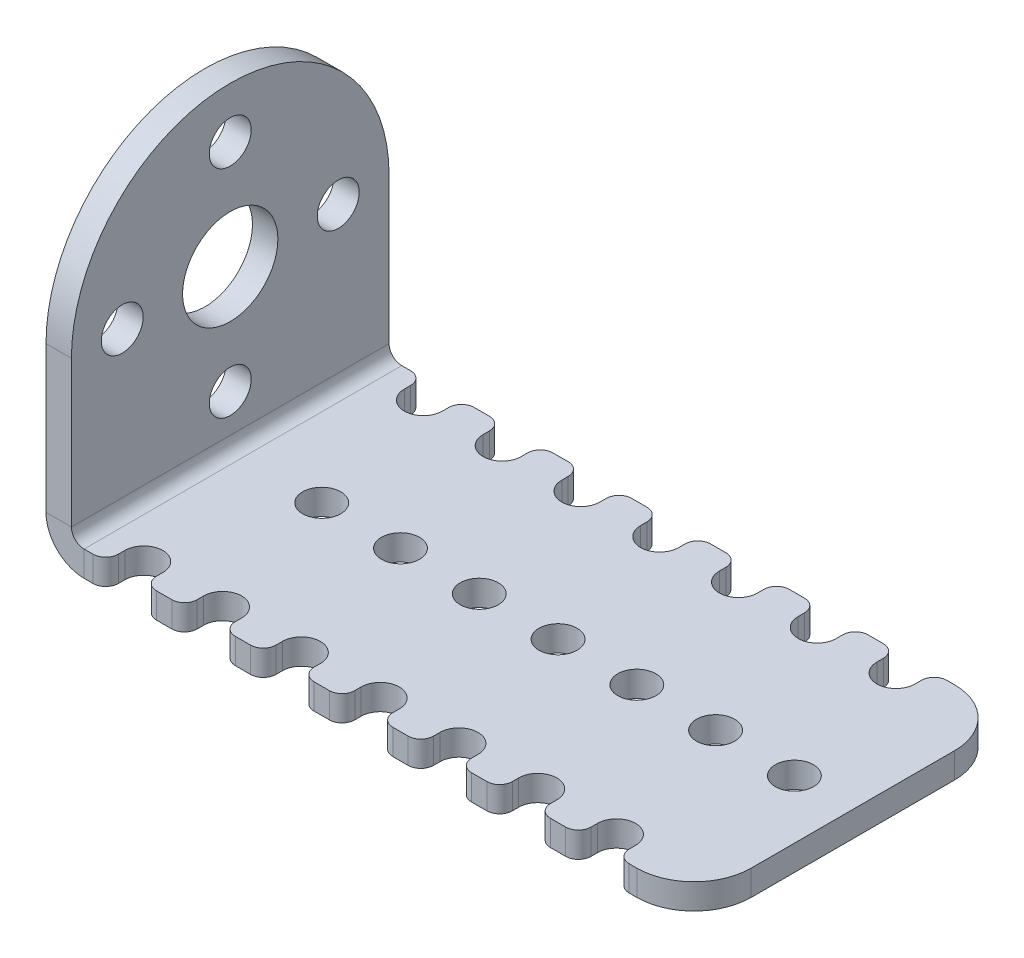
from build123d import *

# Parameters (mm, degrees)
BOSS_EXTRUDE1_DEPTH    = 2
FILLET1_R              = 1
SKETCH2_R              = 1.65
BOSS_EXTRUDE2_DEPTH    = 2
CONVERT_SOLID1_START   = -25
CONVERT_SOLID1_DEPTH   = 25
CONVERT_SOLID1_2_DEPTH = 25


# Read off the part's stored shape, not the designer's step: Convert-Solid1
with BuildPart() as part:
    # Sketch1 → Boss-Extrude1 (new body)
    with BuildSketch(Plane(origin=(0, 0, 0), x_dir=(1, 0, 0), z_dir=(0, 1, 0))):
        with BuildLine():
            Line((51, 12.5), (47.9, 12.5))
            ThreePointArc((47.9, 12.5), (46.4, 11), (44.9, 12.5))
            Line((44.9, 12.5), (41.7, 12.5))
            ThreePointArc((41.7, 12.5), (40.2, 11), (38.7, 12.5))
            Line((38.7, 12.5), (35.5, 12.5))
            ThreePointArc((35.5, 12.5), (34, 11), (32.5, 12.5))
            Line((32.5, 12.5), (29.3, 12.5))
            ThreePointArc((29.3, 12.5), (27.8, 11), (26.3, 12.5))
            Line((26.3, 12.5), (23.1, 12.5))
            ThreePointArc((23.1, 12.5), (21.6, 11), (20.1, 12.5))
            Line((20.1, 12.5), (16.9, 12.5))
            ThreePointArc((16.9, 12.5), (15.4, 11), (13.9, 12.5))
            Line((13.9, 12.5), (10.7, 12.5))
            ThreePointArc((10.7, 12.5), (9.2, 11), (7.7, 12.5))
            Line((7.7, 12.5), (0, 12.5))
            Line((0, 12.5), (0, 0))
            Line((0, 0), (4.7, 0))
            Line((4.7, 0), (4.7, 1.5))
            ThreePointArc((4.7, 1.5), (6.2, 3), (7.7, 1.5))
            Line((7.7, 1.5), (7.7, 0))
            Line((7.7, 0), (10.9, 0))
            Line((10.9, 0), (10.9, 1.5))
            ThreePointArc((10.9, 1.5), (12.4, 3), (13.9, 1.5))
            Line((13.9, 1.5), (13.9, 0))
            Line((13.9, 0), (17.1, 0))
            Line((17.1, 0), (17.1, 1.5))
            ThreePointArc((17.1, 1.5), (18.6, 3), (20.1, 1.5))
            Line((20.1, 1.5), (20.1, 0))
            Line((20.1, 0), (23.3, 0))
            Line((23.3, 0), (23.3, 1.5))
            ThreePointArc((23.3, 1.5), (24.8, 3), (26.3, 1.5))
            Line((26.3, 1.5), (26.3, 0))
            Line((26.3, 0), (29.5, 0))
            Line((29.5, 0), (29.5, 1.5))
            ThreePointArc((29.5, 1.5), (31, 3), (32.5, 1.5))
            Line((32.5, 1.5), (32.5, 0))
            Line((32.5, 0), (35.7, 0))
            Line((35.7, 0), (35.7, 1.5))
            ThreePointArc((35.7, 1.5), (37.2, 3), (38.7, 1.5))
            Line((38.7, 1.5), (38.7, 0))
            Line((38.7, 0), (41.9, 0))
            Line((41.9, 0), (41.9, 1.5))
            ThreePointArc((41.9, 1.5), (43.4, 3), (44.9, 1.5))
            Line((44.9, 1.5), (44.9, 0))
            Line((44.9, 0), (46.5, 0))
            ThreePointArc((46.5, 0), (49.681980515, 1.318019485), (51, 4.5))
            Line((51, 4.5), (51, 12.5))
        make_face()
        with BuildLine():
            ThreePointArc((44.9, 12.5), (46.4, 14), (47.9, 12.5))
            Line((47.9, 12.5), (51, 12.5))
            Line((51, 12.5), (51, 20.5))
            ThreePointArc((51, 20.5), (49.681980515, 23.681980515), (46.5, 25))
            Line((46.5, 25), (44.9, 25))
            Line((44.9, 25), (44.9, 23.5))
            ThreePointArc((44.9, 23.5), (43.4, 22), (41.9, 23.5))
            Line((41.9, 23.5), (41.9, 25))
            Line((41.9, 25), (38.7, 25))
            Line((38.7, 25), (38.7, 23.5))
            ThreePointArc((38.7, 23.5), (37.2, 22), (35.7, 23.5))
            Line((35.7, 23.5), (35.7, 25))
            Line((35.7, 25), (32.5, 25))
            Line((32.5, 25), (32.5, 23.5))
            ThreePointArc((32.5, 23.5), (31, 22), (29.5, 23.5))
            Line((29.5, 23.5), (29.5, 25))
            Line((29.5, 25), (26.3, 25))
            Line((26.3, 25), (26.3, 23.5))
            ThreePointArc((26.3, 23.5), (24.8, 22), (23.3, 23.5))
            Line((23.3, 23.5), (23.3, 25))
            Line((23.3, 25), (20.1, 25))
            Line((20.1, 25), (20.1, 23.5))
            ThreePointArc((20.1, 23.5), (18.6, 22), (17.1, 23.5))
            Line((17.1, 23.5), (17.1, 25))
            Line((17.1, 25), (13.9, 25))
            Line((13.9, 25), (13.9, 23.5))
            ThreePointArc((13.9, 23.5), (12.4, 22), (10.9, 23.5))
            Line((10.9, 23.5), (10.9, 25))
            Line((10.9, 25), (7.7, 25))
            Line((7.7, 25), (7.7, 23.5))
            ThreePointArc((7.7, 23.5), (6.2, 22), (4.7, 23.5))
            Line((4.7, 23.5), (4.7, 25))
            Line((4.7, 25), (0, 25))
            Line((0, 25), (0, 12.5))
            Line((0, 12.5), (7.7, 12.5))
            ThreePointArc((7.7, 12.5), (9.2, 14), (10.7, 12.5))
            Line((10.7, 12.5), (13.9, 12.5))
            ThreePointArc((13.9, 12.5), (15.4, 14), (16.9, 12.5))
            Line((16.9, 12.5), (20.1, 12.5))
            ThreePointArc((20.1, 12.5), (21.6, 14), (23.1, 12.5))
            Line((23.1, 12.5), (26.3, 12.5))
            ThreePointArc((26.3, 12.5), (27.8, 14), (29.3, 12.5))
            Line((29.3, 12.5), (32.5, 12.5))
            ThreePointArc((32.5, 12.5), (34, 14), (35.5, 12.5))
            Line((35.5, 12.5), (38.7, 12.5))
            ThreePointArc((38.7, 12.5), (40.2, 14), (41.7, 12.5))
            Line((41.7, 12.5), (44.9, 12.5))
        make_face()
    extrude(amount=BOSS_EXTRUDE1_DEPTH)

    # Fillet1
    fillet1_edges = [part.edges().sort_by_distance(p)[0] for p in [
        (44.9, 1, 0),
        (41.9, 1, 0),
        (38.7, 1, 0),
        (35.7, 1, 0),
        (32.5, 1, 0),
        (29.5, 1, 0),
        (26.3, 1, 0),
        (23.3, 1, 0),
        (20.1, 1, 0),
        (17.1, 1, 0),
        (13.9, 1, 0),
        (10.9, 1, 0),
        (7.7, 1, 0),
        (4.7, 1, 0),
        (4.7, 1, -25),
        (7.7, 1, -25),
        (10.9, 1, -25),
        (13.9, 1, -25),
        (17.1, 1, -25),
        (20.1, 1, -25),
        (23.3, 1, -25),
        (26.3, 1, -25),
        (29.5, 1, -25),
        (32.5, 1, -25),
        (35.7, 1, -25),
        (38.7, 1, -25),
        (41.9, 1, -25),
        (44.9, 1, -25),
    ]]
    fillet(fillet1_edges, radius=FILLET1_R)

    # Sketch2 → Boss-Extrude2 (add)
    # profile 1 of 3: a face of its own
    with BuildSketch(Plane(origin=(0, 0, 0), x_dir=(0, 0, -1), z_dir=(1, 0, 0))):
        with BuildLine():
            Line((0, 0), (25, 0))
            Line((25, 0), (25, 14.5))
            ThreePointArc((25, 14.5), (12.5, 2), (0, 14.5))
            Line((0, 14.5), (0, 0))
        make_face()
    # profile 2 of 3: a face of its own
    with BuildSketch(Plane(origin=(0, 0, 0), x_dir=(0, 0, -1), z_dir=(1, 0, 0))):
        with BuildLine():
            ThreePointArc((0, 14.5), (12.5, 2), (25, 14.5))
            Line((25, 14.5), (22.65, 14.5))
            ThreePointArc((22.65, 14.5), (21, 12.85), (19.35, 14.5))
            Line((19.35, 14.5), (16.25, 14.5))
            ThreePointArc((16.25, 14.5), (12.5, 10.75), (8.75, 14.5))
            Line((8.75, 14.5), (5.65, 14.5))
            ThreePointArc((5.65, 14.5), (4, 12.85), (2.35, 14.5))
            Line((2.35, 14.5), (0, 14.5))
        make_face()
        with Locations((12.5, 6)):
            Circle(SKETCH2_R, mode=Mode.SUBTRACT)
    # profile 3 of 3: a face of its own
    with BuildSketch(Plane(origin=(0, 0, 0), x_dir=(0, 0, -1), z_dir=(1, 0, 0))):
        with BuildLine():
            Line((22.65, 14.5), (25, 14.5))
            ThreePointArc((25, 14.5), (12.5, 27), (0, 14.5))
            Line((0, 14.5), (2.35, 14.5))
            ThreePointArc((2.35, 14.5), (4, 16.15), (5.65, 14.5))
            Line((5.65, 14.5), (8.75, 14.5))
            ThreePointArc((8.75, 14.5), (12.5, 18.25), (16.25, 14.5))
            Line((16.25, 14.5), (19.35, 14.5))
            ThreePointArc((19.35, 14.5), (21, 16.15), (22.65, 14.5))
        make_face()
        with Locations((12.5, 23)):
            Circle(SKETCH2_R, mode=Mode.SUBTRACT)
    extrude(amount=BOSS_EXTRUDE2_DEPTH)

    # Convert-Solid1 outline → Convert-Solid1 (cut)
    with BuildSketch(Plane.XY.offset(CONVERT_SOLID1_START)):
        with BuildLine():
            ThreePointArc((3, 0), (0.878679656, 0.878679656), (0, 3))
            Line((0, 3), (0, 0))
            Line((0, 0), (3, 0))
        make_face()
    extrude(amount=CONVERT_SOLID1_DEPTH, mode=Mode.SUBTRACT)

    # Convert-Solid1 2 outline → Convert-Solid1 2 (add)
    with BuildSketch(Plane.XY.offset(CONVERT_SOLID1_START)):
        with BuildLine():
            ThreePointArc((3, 2), (2.292893219, 2.292893219), (2, 3))
            Line((2, 3), (2, 2))
            Line((2, 2), (3, 2))
        make_face()
    extrude(amount=CONVERT_SOLID1_2_DEPTH)


solid = part.part
